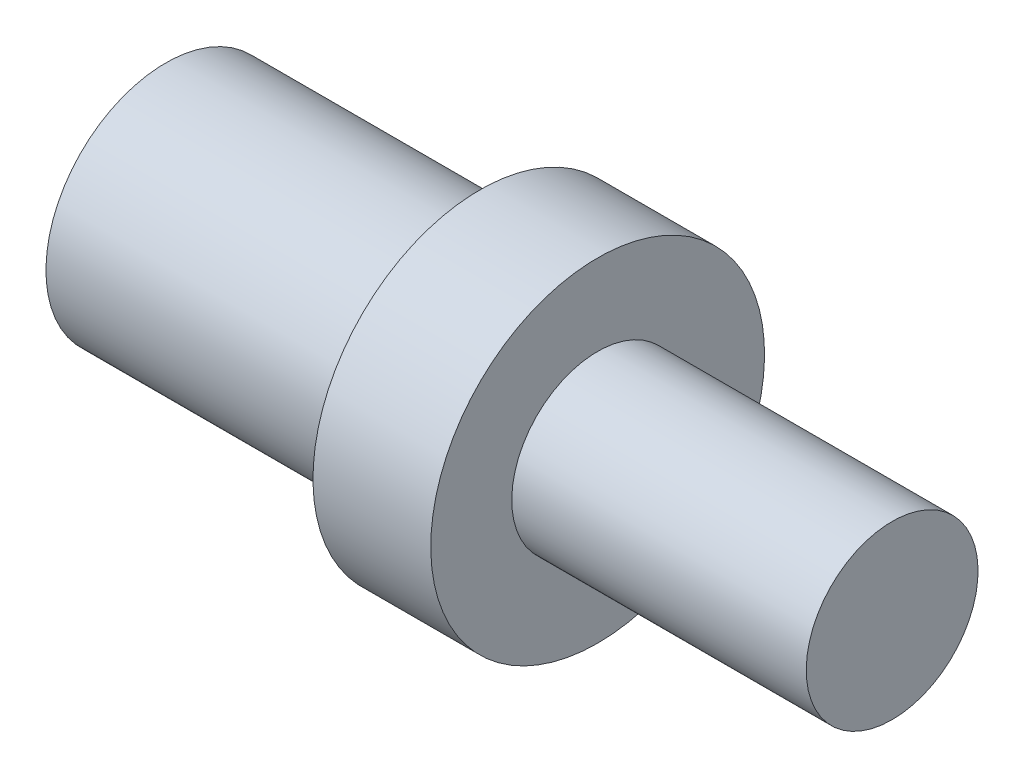
from build123d import *


with BuildPart() as part:
    # Sketch1 → Revolve1 (revolve)
    with BuildSketch(Plane.XY):
        Polygon((0, 10.795), (-7.62, 10.795), (-7.62, 7.747), (-27.94, 7.747), (-27.94, 0), (19.05, 0), (19.05, 5.55625), (0, 5.55625), align=None)
    revolve(axis=Axis((-27.94, 0, 0), (1, 0, 0)))


solid = part.part
